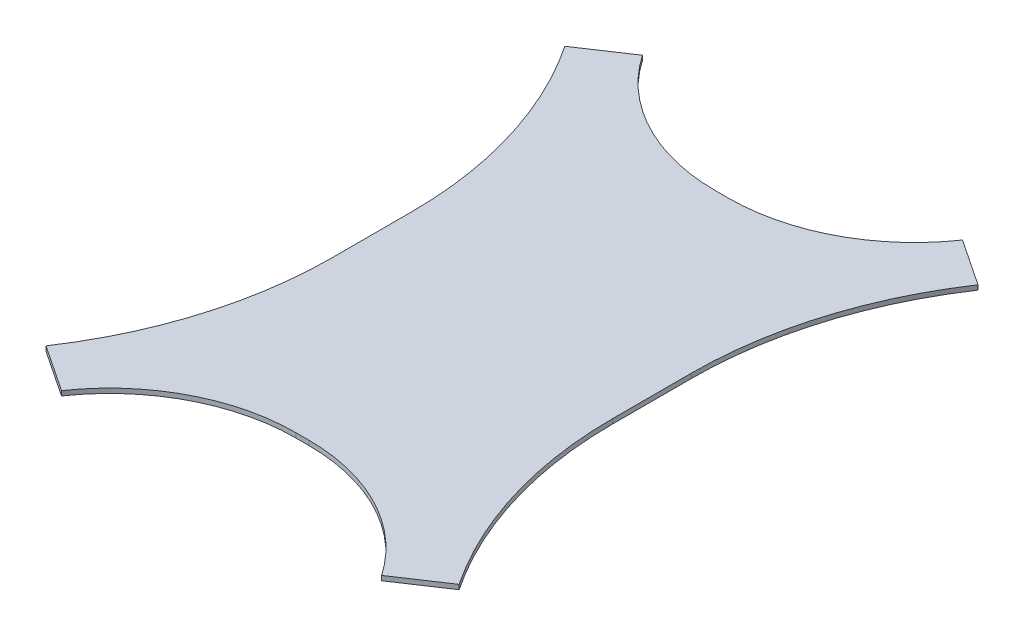
from build123d import *

# Parameters (mm, degrees)
IZIM1_W                     = 120
IZIM1_H                     = 180
Y_KSEKLIK_EKSTR_ZYON1_DEPTH = 1
Y_KSEKLIK_EKSTR_ZYON3_REACH = 252.002
IZIM4_W                     = 24
IZIM4_H                     = 2
AYNALAMA2_COPY_1_REACH      = 252.002
AYNALAMA2_COPY_1_SKETCH_W   = 24
AYNALAMA2_COPY_1_SKETCH_H   = 2
RADYUS3_R                   = 80
RADYUS4_R                   = 80
RADYUS5_R                   = 170
RADYUS6_R                   = 170


with BuildPart() as part:
    # Çizim1 → Yükseklik-Ekstrüzyon1 (new, symmetric)
    with BuildSketch(Plane(origin=(0, 0, 0), x_dir=(1, 0, 0), z_dir=(0, 1, 0))):
        Rectangle(IZIM1_W, IZIM1_H)
    extrude(amount=Y_KSEKLIK_EKSTR_ZYON1_DEPTH, both=True)

    # Çizim4 → Yükseklik-Ekstrüzyon3 (add, up to next)
    with BuildSketch(Plane(origin=(78.675049056, 0, -118.012573584), x_dir=(-0.8320502943378438, 0, -0.5547001962252289), z_dir=(0.5547001962252289, 0, -0.8320502943378438)), mode=Mode.PRIVATE) as y_kseklik_ekstr_zyon3_sk1:
        Rectangle(IZIM4_W, IZIM4_H)
    y_kseklik_ekstr_zyon3_tool1 = extrude(y_kseklik_ekstr_zyon3_sk1.sketch, amount=-Y_KSEKLIK_EKSTR_ZYON3_REACH, mode=Mode.PRIVATE) - part.part
    y_kseklik_ekstr_zyon3 = y_kseklik_ekstr_zyon3_tool1.solids().sort_by_distance((78.675049, 0, -118.012574))[0]
    add(y_kseklik_ekstr_zyon3)

    # Aynalama1: Yükseklik-Ekstrüzyon3 across plane
    add(y_kseklik_ekstr_zyon3.mirror(Plane(origin=(0, 0, 0), x_dir=(0, 0, 1), z_dir=(1, 0, 0))))

    # Aynalama2: Yükseklik-Ekstrüzyon3 across plane
    add(y_kseklik_ekstr_zyon3.mirror(Plane.XY))

    # Aynalama2 copy 1 sketch → Aynalama2 copy 1 (add, up to next)
    with BuildSketch(Plane(origin=(-78.675049056, 0, 118.012573584), x_dir=(0.8320502943378438, 0, 0.5547001962252289), z_dir=(-0.5547001962252289, 0, 0.8320502943378438)), mode=Mode.PRIVATE) as aynalama2_copy_1_sk1:
        Rectangle(AYNALAMA2_COPY_1_SKETCH_W, AYNALAMA2_COPY_1_SKETCH_H)
    aynalama2_copy_1_tool1 = extrude(aynalama2_copy_1_sk1.sketch, amount=-AYNALAMA2_COPY_1_REACH, mode=Mode.PRIVATE) - part.part
    add(aynalama2_copy_1_tool1.solids().sort_by_distance((-78.675049, 0, 118.012574))[0])

    # Radyus3
    # the kernel refuses this fillet: 80 mm, written as the material it adds along each edge
    with BuildSketch(Plane(origin=(45.577794898, 1, -90), x_dir=(-1, 0, 0), z_dir=(0, -1, 0))) as radyus3_piece_1:
        with BuildLine():
            CenterArc((42.804708678, 80), RADYUS3_R, 214.516100583, 55.483899417)
            Line((-23.112650626, 34.668975939), (-24.430997812, 33.762355458))
            ThreePointArc((-24.430997812, 33.762355458), (-12.887605784, 16.446967656), (-1.331280471, -0.887520314))
            Line((-1.331280471, -0.887520314), (0, -1.6))
            Line((0, -1.6), (42.804708678, -1.6))
            Line((42.804708678, -1.6), (42.804708678, 0))
        make_face()
    extrude(amount=2)
    with BuildSketch(Plane(origin=(-45.577794898, 1, -90), x_dir=(-0.5547001962252296, 0, -0.8320502943378434), z_dir=(0, -1, 0))) as radyus3_piece_2:
        with BuildLine():
            CenterArc((42.820243244, 79.991686152), RADYUS3_R, 213.690067526, 55.483899417)
            Line((-23.743780303, 35.615670454), (-25.075060774, 34.72815014))
            Line((-25.075060774, 34.72815014), (-1.331280471, -0.887520314))
            Line((-1.331280471, -0.887520314), (0, -1.6))
            ThreePointArc((0, -1.6), (20.833461736, -1.6), (41.643857077, -1.599833723))
            Line((41.643857077, -1.599833723), (41.666923472, 0))
        make_face()
    extrude(amount=2)

    # Radyus4
    # the kernel refuses this fillet: 80 mm, written as the material it adds along each edge
    with BuildSketch(Plane(origin=(-45.577794898, 1, 90), x_dir=(1, 0, 0), z_dir=(0, -1, 0))) as radyus4_piece_1:
        with BuildLine():
            CenterArc((42.804708678, 80), RADYUS4_R, 214.516100583, 55.483899417)
            Line((-23.112650626, 34.668975939), (-24.430997812, 33.762355458))
            ThreePointArc((-24.430997812, 33.762355458), (-12.887605784, 16.446967656), (-1.331280471, -0.887520314))
            Line((-1.331280471, -0.887520314), (0, -1.6))
            Line((0, -1.6), (42.804708678, -1.6))
            Line((42.804708678, -1.6), (42.804708678, 0))
        make_face()
    extrude(amount=2)
    with BuildSketch(Plane(origin=(45.577794898, 1, 90), x_dir=(0.5547001962252287, 0, 0.8320502943378439), z_dir=(0, -1, 0))) as radyus4_piece_2:
        with BuildLine():
            CenterArc((42.820243244, 79.991686152), RADYUS4_R, 213.690067526, 55.483899417)
            Line((-23.743780303, 35.615670454), (-25.075060774, 34.72815014))
            Line((-25.075060774, 34.72815014), (-1.331280471, -0.887520314))
            Line((-1.331280471, -0.887520314), (0, -1.6))
            ThreePointArc((0, -1.6), (20.833461736, -1.6), (41.643857077, -1.599833723))
            Line((41.643857077, -1.599833723), (41.666923472, 0))
        make_face()
    extrude(amount=2)

    # Radyus5
    radyus5_edges = [part.edges().sort_by_distance(p)[0] for p in [
        (-60, 0, -68.366692347),
        (-60, 0, 68.366692347),
    ]]
    fillet(radyus5_edges, radius=RADYUS5_R)

    # Radyus6
    radyus6_edges = [part.edges().sort_by_distance(p)[0] for p in [
        (60, 0, -68.366692347),
        (60, 0, 68.366692347),
    ]]
    fillet(radyus6_edges, radius=RADYUS6_R)


solid = part.part
